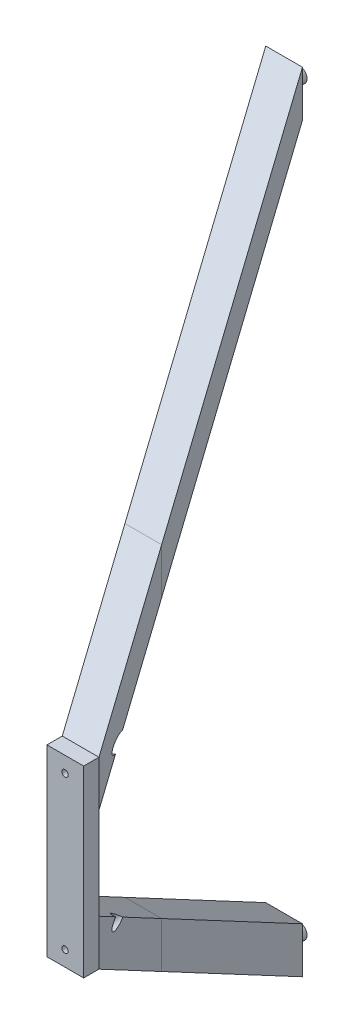
from build123d import *
from OCP.BRepAlgoAPI import BRepAlgoAPI_Cut
from OCP.TopTools import TopTools_ListOfShape

# Parameters (mm, degrees)
SKETCH1_W           = 24
SKETCH1_H           = 119.99962
SKETCH1_R           = 2.081422
SKETCH1_R_2         = 2.082018
BOSS_EXTRUDE1_DEPTH = 10
BOSS_EXTRUDE2_DEPTH = 24
SKETCH7_R           = 5
BOSS_EXTRUDE3_DEPTH = 10
SKETCH8_R           = 2.082018
SKETCH8_R_2         = 2.081422
CUT_EXTRUDE1_DEPTH  = 436.423913
CUT_EXTRUDE2_START  = 10
SKETCH9_R           = 4.081422
SKETCH9_R_2         = 4.082018
CUT_EXTRUDE2_DEPTH  = 426.423913
SKETCH10_W          = 18
SKETCH10_H          = 24
CUT_EXTRUDE3_DEPTH  = 30
SKETCH11_W          = 18
SKETCH11_H          = 24
CUT_EXTRUDE4_DEPTH  = 30
SKETCH12_W          = 17.6
SKETCH12_H          = 23.6
BOSS_EXTRUDE4_DEPTH = 30
SKETCH13_W          = 17.6
SKETCH13_H          = 23.6
BOSS_EXTRUDE5_DEPTH = 30


with BuildPart() as part:
    # Sketch1 → Boss-Extrude1 (new body)
    with BuildSketch(Plane(origin=(0, 0, 0), x_dir=(1, 0, 0), z_dir=(0, 0, -1))):
        with Locations((12, 59.99981)):
            Rectangle(SKETCH1_W, SKETCH1_H)
        with Locations(Location((11.81884, 10.197, 0), (0, 0, 180))):
            Circle(SKETCH1_R, mode=Mode.SUBTRACT)
        with Locations(Location((11.81883, 110.0343, 0), (0, 0, 180))):
            Circle(SKETCH1_R_2, mode=Mode.SUBTRACT)
    extrude(amount=BOSS_EXTRUDE1_DEPTH)

    # Sketch6 → Boss-Extrude2 (add, along a direction that is not the sketch's normal)
    with BuildSketch(Plane(origin=(3.940054, 0, -1.921693), x_dir=(0.43837114678907835, 0, 0.8987940462991666), z_dir=(-0.8987940462991665, 0, 0.4383711467890783))):
        Polygon((-8.98794, 0), (-297.940661, 197.50019), (-297.940661, 167.50019), (-8.98794, -30), align=None)
        Polygon((-297.940661, -287.49981), (-297.940661, -317.49981), (-8.98794, -119.99962), (-8.98794, -89.99962), align=None)
    extrude(amount=-BOSS_EXTRUDE2_DEPTH, dir=(-1, 0, 0))

    # Sketch7 → Boss-Extrude3 (add)
    with BuildSketch(Plane(origin=(0, 0, -269.708985), x_dir=(1, 0, 0), z_dir=(0, 0, -1))):
        with Locations(Location((-114.668536, -182.50019, 0), (0, 0, 270))):
            Circle(SKETCH7_R)
        with Locations(Location((-114.668536, 302.49981, 0), (0, 0, 270))):
            Circle(SKETCH7_R)
    extrude(amount=BOSS_EXTRUDE3_DEPTH)


with BuildPart() as cut_extrude1_tool:
    # Sketch8 → Cut-Extrude1 (new, through all)
    with BuildSketch(Plane(origin=(0, 0, -10), x_dir=(1, 0, 0), z_dir=(0, 0, -1))):
        with Locations(Location((11.81883, 110.0343, 0), (0, 0, 286.999931))):
            Circle(SKETCH8_R)
        with Locations(Location((11.81884, 10.197, 0), (0, 0, 69.457399))):
            Circle(SKETCH8_R_2)
    extrude(amount=CUT_EXTRUDE1_DEPTH)


with BuildPart() as part_1:
    add(part.part)

    # Cut-Extrude1: cut by cut_extrude1_tool, with a tolerance
    cut_extrude1_stock = TopTools_ListOfShape()
    cut_extrude1_stock.Append(part_1.part.wrapped)
    cut_extrude1_tools = TopTools_ListOfShape()
    cut_extrude1_tools.Append(cut_extrude1_tool.part.wrapped)
    cut_extrude1_cut = BRepAlgoAPI_Cut()
    cut_extrude1_cut.SetArguments(cut_extrude1_stock)
    cut_extrude1_cut.SetTools(cut_extrude1_tools)
    cut_extrude1_cut.SetFuzzyValue(0.00001)
    cut_extrude1_cut.Build()
    add(Compound.cast(cut_extrude1_cut.Shape()).solids(), mode=Mode.REPLACE)

    # Sketch9 → Cut-Extrude2 (cut, through all)
    with BuildSketch(Plane(origin=(0, 0, -10), x_dir=(1, 0, 0), z_dir=(0, 0, -1)).offset(CUT_EXTRUDE2_START)):
        with Locations(Location((11.81884, 10.197, 0), (0, 0, 63.478176))):
            Circle(SKETCH9_R)
        with Locations(Location((11.81883, 110.0343, 0), (0, 0, 294.753869))):
            Circle(SKETCH9_R_2)
    extrude(amount=CUT_EXTRUDE2_DEPTH, mode=Mode.SUBTRACT)


with BuildPart() as body_2:
    # Split1: the piece on the far side of the plane
    add(part_1.part)
    split(bisect_by=Plane(origin=(0, 0, -90), x_dir=(-1, 0, 0), z_dir=(0, 0, -1)), keep=Keep.BOTTOM)


with BuildPart() as part_2:
    add(part_1.part)

    # Split1
    split(bisect_by=Plane(origin=(0, 0, -90), x_dir=(-1, 0, 0), z_dir=(0, 0, -1)), keep=Keep.TOP)

    # Sketch10 → Cut-Extrude3 (cut, along a direction that is not the sketch's normal)
    with BuildSketch(Plane(origin=(0, 0, -90), x_dir=(-1, 0, 0), z_dir=(0, 0, -1))):
        with Locations((27.018607, -165.837004)):
            Rectangle(SKETCH10_W, SKETCH10_H)
    extrude(amount=CUT_EXTRUDE3_DEPTH, dir=(-0.36191010187111433, -0.5642862571428574, -0.7420256721726983), mode=Mode.SUBTRACT)

    # Sketch11 → Cut-Extrude4 (cut, along a direction that is not the sketch's normal)
    with BuildSketch(Plane(origin=(0, 0, -90), x_dir=(-1, 0, 0), z_dir=(0, 0, -1))):
        with Locations((27.018607, 45.837384)):
            Rectangle(SKETCH11_W, SKETCH11_H)
    extrude(amount=CUT_EXTRUDE4_DEPTH, dir=(-0.36191010187111433, 0.5642862571428574, -0.7420256721726983), mode=Mode.SUBTRACT)


with BuildPart() as body_3:
    # Sketch12 → Boss-Extrude4 (new, along a direction that is not the sketch's normal)
    with BuildSketch(Plane(origin=(0, 0, -90), x_dir=(-1, 0, 0), z_dir=(0, 0, -1))):
        with Locations((27.018607, -165.837004)):
            Rectangle(SKETCH12_W, SKETCH12_H)
    extrude(amount=BOSS_EXTRUDE4_DEPTH, dir=(-0.36191010187111433, -0.5642862571428575, -0.7420256721726983))


with BuildPart() as body_4:
    # Sketch13 → Boss-Extrude5 (new, along a direction that is not the sketch's normal)
    with BuildSketch(Plane(origin=(0, 0, -90), x_dir=(-1, 0, 0), z_dir=(0, 0, -1))):
        with Locations((27.018607, 45.837384)):
            Rectangle(SKETCH13_W, SKETCH13_H)
    extrude(amount=BOSS_EXTRUDE5_DEPTH, dir=(-0.36191010187111433, 0.5642862571428574, -0.7420256721726983))

    # Combine1: union body 3, body 2
    add(body_3.part)
    add(body_2.part)


solid = Compound([part_2.part, body_4.part])
